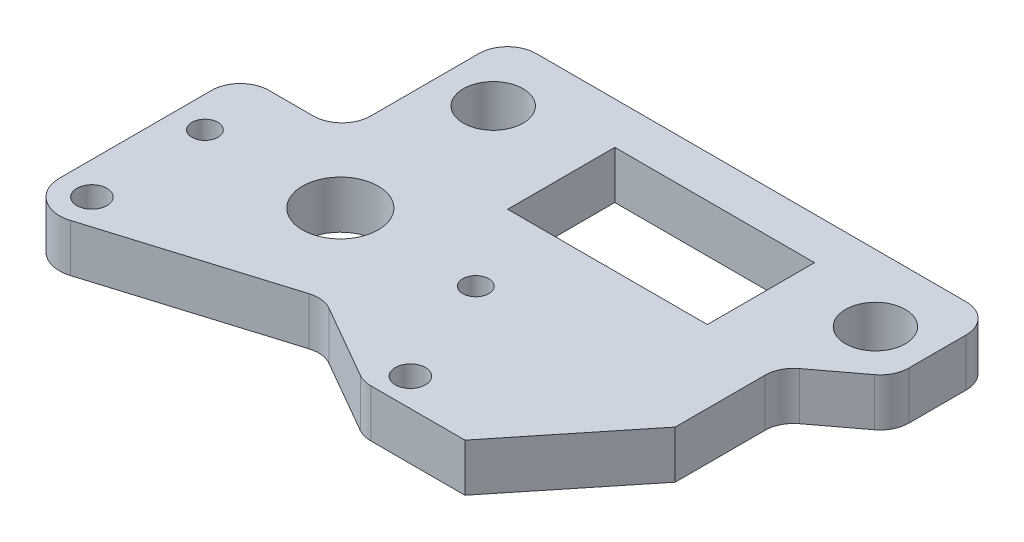
from build123d import *

# Parameters (mm, degrees)
SKETCH4_R           = 2
SKETCH4_R_2         = 1.7272
SKETCH4_R_3         = 5.04
SKETCH4_R_4         = 3.96875
SKETCH4_W           = 26.542968991
SKETCH4_H           = 14.242568727
BOSS_EXTRUDE2_DEPTH = 6.35


with BuildPart() as part:
    # Sketch4 → Boss-Extrude2 (new body)
    with BuildSketch(Plane(origin=(0, 0, 0), x_dir=(1, 0, 0), z_dir=(0, 1, 0))):
        with BuildLine():
            Line((22.483900583, -18.4375), (34.998680623, -18.4375))
            Line((34.998680623, -18.4375), (47.468481715, -2.956648972))
            Line((47.468481715, -2.956648972), (47.468481715, 8.985116992))
            ThreePointArc((47.468481715, 8.985116992), (47.868781798, 10.685130659), (48.985566477, 12.027918285))
            Line((48.985566477, 12.027918285), (54.680415238, 16.319294633))
            ThreePointArc((54.680415238, 16.319294633), (55.797199918, 17.662082259), (56.1975, 19.362095927))
            Line((56.1975, 19.362095927), (56.1975, 26.9875))
            ThreePointArc((56.1975, 26.9875), (55.081576836, 29.681576836), (52.3875, 30.7975))
            Line((52.3875, 30.7975), (-4.7625, 30.7975))
            ThreePointArc((-4.7625, 30.7975), (-7.456576836, 29.681576836), (-8.5725, 26.9875))
            Line((-8.5725, 26.9875), (-8.5725, 12.607500122))
            ThreePointArc((-8.5725, 12.607500122), (-9.688423164, 9.913423286), (-12.3825, 8.797500122))
            Line((-12.3825, 8.797500122), (-18.288, 8.797500122))
            ThreePointArc((-18.288, 8.797500122), (-20.982076836, 7.681576958), (-22.098, 4.987500122))
            Line((-22.098, 4.987500122), (-22.098, -15.24))
            ThreePointArc((-22.098, -15.24), (-20.348558836, -18.710969534), (-16.517810325, -19.369406885))
            Line((-16.517810325, -19.369406885), (7.765559219, -11.946980575))
            ThreePointArc((7.765559219, -11.946980575), (9.307944036, -11.804768953), (10.779476649, -12.288263354))
            Line((10.779476649, -12.288263354), (20.583679925, -17.929811531))
            ThreePointArc((20.583679925, -17.929811531), (21.500464498, -18.308390309), (22.483900583, -18.4375))
        make_face()
        with Locations((-17.78, -15.24)):
            Circle(SKETCH4_R, mode=Mode.SUBTRACT)
        with Locations((-18.000000004, 0)):
            Circle(SKETCH4_R_2, mode=Mode.SUBTRACT)
        Circle(SKETCH4_R_3, mode=Mode.SUBTRACT)
        with Locations((24.012521227, -14.703599027)):
            Circle(SKETCH4_R, mode=Mode.SUBTRACT)
        with Locations((18.000000004, 0)):
            Circle(SKETCH4_R_2, mode=Mode.SUBTRACT)
        with Locations((-1.5875, 21.9075)):
            Circle(SKETCH4_R_4, mode=Mode.SUBTRACT)
        with Locations((24.534086879, 18.097743247)):
            Rectangle(SKETCH4_W, SKETCH4_H, mode=Mode.SUBTRACT)
        with Locations((49.2125, 21.9075)):
            Circle(SKETCH4_R_4, mode=Mode.SUBTRACT)
    extrude(amount=-BOSS_EXTRUDE2_DEPTH)


solid = part.part
